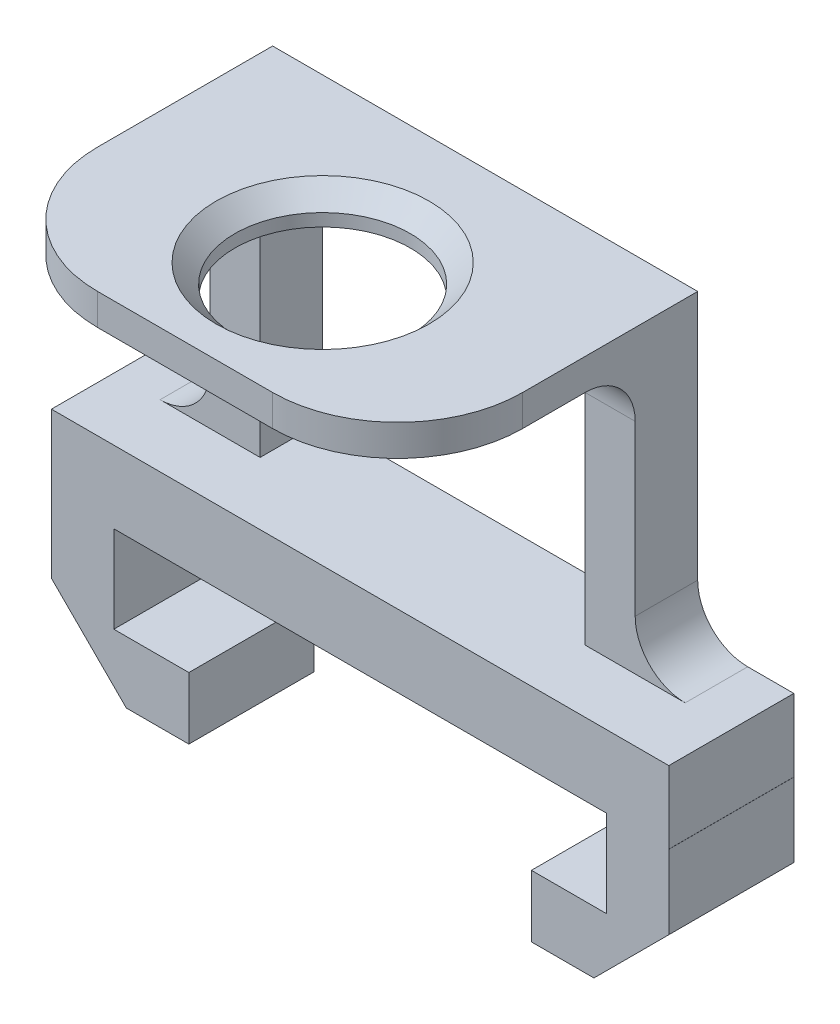
from build123d import *

# Parameters (mm, degrees)
SKETCH2_W           = 24.690663142
SKETCH2_H           = 2.894566797
BOSS_EXTRUDE2_DEPTH = 3
SKETCH2_2_W         = 24.690663142
SKETCH2_2_H         = 2.894566797
BOSS_EXTRUDE3_DEPTH = 2
SKETCH8_W           = 2.5
SKETCH8_H           = 5
BOSS_EXTRUDE4_DEPTH = 5.96
SKETCH10_W          = 5
SKETCH10_H          = 2.48
BOSS_EXTRUDE5_DEPTH = 3
SKETCH11_W          = 5
SKETCH11_H          = 2.48
BOSS_EXTRUDE6_DEPTH = 3
SKETCH12_W          = 17
SKETCH12_H          = 2.5
BOSS_EXTRUDE7_DEPTH = 12
CUT_EXTRUDE7_REACH  = 38.583
SKETCH14_W          = 13
SKETCH14_H          = 10.75
SKETCH16_W          = 17
SKETCH16_H          = 1.25
BOSS_EXTRUDE8_DEPTH = 9.5
CUT_EXTRUDE8_REACH  = 28.219
SKETCH17_R          = 3.51
CHAMFER1_SIZE       = 3
CHAMFER2_SIZE       = 3
LENS_CHAMFER_SIZE   = 0.75
FILLET13_R          = 2
FILLET14_R          = 2
FILLET15_R          = 5


with BuildPart() as part:
    # Sketch2 → Boss-Extrude2 (new body)
    with BuildSketch(Plane.XY):
        with Locations((0, 20.897290887)):
            Rectangle(SKETCH2_W, SKETCH2_H)
    extrude(amount=BOSS_EXTRUDE2_DEPTH)

    # Sketch2<2> → Boss-Extrude3 (add)
    with BuildSketch(Plane.XY):
        with Locations((0, 20.897290887)):
            Rectangle(SKETCH2_2_W, SKETCH2_2_H)
    extrude(amount=-BOSS_EXTRUDE3_DEPTH)

    # Sketch8 → Boss-Extrude4 (add)
    with BuildSketch(Plane(origin=(0, 19.450007488, 0), x_dir=(-1, 0, 0), z_dir=(0, -1, 0))):
        with Locations((11.1, -0.5)):
            Rectangle(SKETCH8_W, SKETCH8_H)
        with Locations((-11.1, -0.5)):
            Rectangle(SKETCH8_W, SKETCH8_H)
    extrude(amount=BOSS_EXTRUDE4_DEPTH)

    # Sketch10 → Boss-Extrude5 (add)
    with BuildSketch(Plane.ZY.offset(-9.85)):
        with Locations((0.5, 14.730007488)):
            Rectangle(SKETCH10_W, SKETCH10_H)
    extrude(amount=BOSS_EXTRUDE5_DEPTH)

    # Sketch11 → Boss-Extrude6 (add)
    with BuildSketch(Plane(origin=(-9.85, 0, 0), x_dir=(0, 0, -1), z_dir=(1, 0, 0))):
        with Locations((-0.5, 14.730007488)):
            Rectangle(SKETCH11_W, SKETCH11_H)
    extrude(amount=BOSS_EXTRUDE6_DEPTH)

    # Sketch12 → Boss-Extrude7 (add)
    with BuildSketch(Plane(origin=(0, 22.344574285, 0), x_dir=(1, 0, 0), z_dir=(0, 1, 0))):
        with Locations((0, 0.75)):
            Rectangle(SKETCH12_W, SKETCH12_H)
    extrude(amount=BOSS_EXTRUDE7_DEPTH)

    # Sketch14 → Cut-Extrude7 (cut, up to next)
    with BuildSketch(Plane.XY.offset(0.5), mode=Mode.PRIVATE) as cut_extrude7_sk1:
        with Locations((0, 27.719574285)):
            Rectangle(SKETCH14_W, SKETCH14_H)
    cut_extrude7_tool1 = extrude(cut_extrude7_sk1.sketch, amount=-CUT_EXTRUDE7_REACH, mode=Mode.PRIVATE) & part.part
    add(cut_extrude7_tool1.solids().sort_by_distance((0, 27.719574, 0.5))[0], mode=Mode.SUBTRACT)

    # Sketch16 → Boss-Extrude8 (add)
    with BuildSketch(Plane.XY.offset(0.5)):
        with Locations((0, 33.719574285)):
            Rectangle(SKETCH16_W, SKETCH16_H)
    extrude(amount=BOSS_EXTRUDE8_DEPTH)

    # Sketch17 → Cut-Extrude8 (cut, up to next)
    with BuildSketch(Plane(origin=(0, 34.344574285, 0), x_dir=(1, 0, 0), z_dir=(0, 1, 0)), mode=Mode.PRIVATE) as cut_extrude8_sk1:
        with Locations((0, -4.5)):
            Circle(SKETCH17_R)
    cut_extrude8_tool1 = extrude(cut_extrude8_sk1.sketch, amount=-CUT_EXTRUDE8_REACH, mode=Mode.PRIVATE) & part.part
    add(cut_extrude8_tool1.solids().sort_by_distance((0, 34.344574, 4.5))[0], mode=Mode.SUBTRACT)

    # Chamfer1
    chamfer1_edges = [part.edges().sort_by_distance(p)[0] for p in [
        (-12.35, 13.490007488, 0.5),
    ]]
    chamfer(chamfer1_edges, length=CHAMFER1_SIZE)

    # Chamfer2
    chamfer2_edges = [part.edges().sort_by_distance(p)[0] for p in [
        (12.35, 13.490007488, 0.5),
    ]]
    chamfer(chamfer2_edges, length=CHAMFER2_SIZE)

    # Lens Chamfer
    lens_chamfer_edges = [part.edges().sort_by_distance(p)[0] for p in [
        (-3.51, 34.344574285, 4.5),
    ]]
    chamfer(lens_chamfer_edges, length=LENS_CHAMFER_SIZE)

    # Fillet13
    fillet13_edges = [part.edges().sort_by_distance(p)[0] for p in [
        (-7.5, 33.094574285, 0.5),
        (7.5, 33.094574285, 0.5),
    ]]
    fillet(fillet13_edges, radius=FILLET13_R)

    # Fillet14
    fillet14_edges = [part.edges().sort_by_distance(p)[0] for p in [
        (8.5, 22.344574285, -0.75),
        (-8.5, 22.344574285, -0.75),
    ]]
    fillet(fillet14_edges, radius=FILLET14_R)

    # Fillet15
    fillet15_edges = [part.edges().sort_by_distance(p)[0] for p in [
        (-8.5, 33.719574285, 10),
        (8.5, 33.719574285, 10),
    ]]
    fillet(fillet15_edges, radius=FILLET15_R)


solid = part.part
